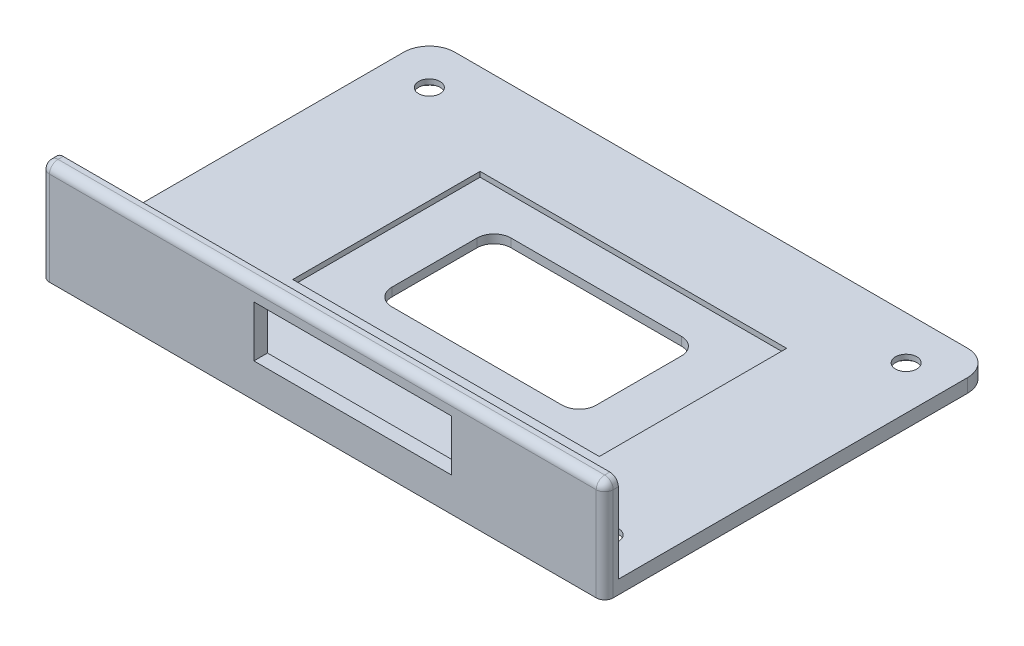
from build123d import *

# Parameters (mm, degrees)
EXTRUDE_1_DEPTH        = 1.6
SKETCH_2_W             = 23.2
SKETCH_2_H             = 6
EXTRUDE_719_DEPTH      = 1.6
CUT_EXTRUDE_1150_REACH = 43.961
SKETCH_5_R             = 2.6
CUT_EXTRUDE_1612_DEPTH = 1
CUT_EXTRUDE_1748_REACH = 44.114
SKETCH_7_R             = 1.25
SKETCH_9_W             = 36
SKETCH_9_H             = 22
CUT_EXTRUDE_2286_DEPTH = 0.6
FILLET_2_R             = 1


with BuildPart() as part:
    # 草图1 → 凸台-拉伸1 (new body)
    with BuildSketch(Plane(origin=(0, 0, 0), x_dir=(1, 0, 0), z_dir=(0, 1, 0))):
        with BuildLine():
            Line((-33.1, -22), (33.1, -22))
            Line((33.1, -22), (33.1, 19))
            ThreePointArc((33.1, 19), (32.221320344, 21.121320344), (30.1, 22))
            Line((30.1, 22), (-30.1, 22))
            ThreePointArc((-30.1, 22), (-32.221320344, 21.121320344), (-33.1, 19))
            Line((-33.1, 19), (-33.1, -22))
        make_face()
    extrude(amount=EXTRUDE_1_DEPTH)

    # 草图2 → Extrude 719 (add)
    with BuildSketch(Plane.XY.offset(22)):
        with BuildLine():
            Line((-33.1, 0), (33.1, 0))
            Line((33.1, 0), (33.1, 11))
            ThreePointArc((33.1, 11), (32.807106781, 11.707106781), (32.1, 12))
            Line((32.1, 12), (17.1, 12))
            Line((17.1, 12), (-9.1, 12))
            Line((-9.1, 12), (-32.1, 12))
            ThreePointArc((-32.1, 12), (-32.807106781, 11.707106781), (-33.1, 11))
            Line((-33.1, 11), (-33.1, 0))
        make_face()
        with Locations((3.5, 7)):
            Rectangle(SKETCH_2_W, SKETCH_2_H, mode=Mode.SUBTRACT)
    extrude(amount=EXTRUDE_719_DEPTH)

    # 草图3 → Cut-Extrude 1150 (cut, up to next)
    with BuildSketch(Plane(origin=(0, 1.6, 0), x_dir=(1, 0, 0), z_dir=(0, 1, 0)), mode=Mode.PRIVATE) as cut_extrude_1150_sk1:
        with BuildLine():
            Line((-8.5, -7), (11.5, -7))
            ThreePointArc((11.5, -7), (12.914213562, -6.414213562), (13.5, -5))
            Line((13.5, -5), (13.5, 5))
            ThreePointArc((13.5, 5), (12.914213562, 6.414213562), (11.5, 7))
            Line((11.5, 7), (-8.5, 7))
            ThreePointArc((-8.5, 7), (-9.914213562, 6.414213562), (-10.5, 5))
            Line((-10.5, 5), (-10.5, -5))
            ThreePointArc((-10.5, -5), (-9.914213562, -6.414213562), (-8.5, -7))
        make_face()
    cut_extrude_1150_tool1 = extrude(cut_extrude_1150_sk1.sketch, amount=-CUT_EXTRUDE_1150_REACH, mode=Mode.PRIVATE) & part.part
    add(cut_extrude_1150_tool1.solids().sort_by_distance((1.5, 1.6, 0))[0], mode=Mode.SUBTRACT)

    # 草图5 → Cut-Extrude 1612 (cut)
    with BuildSketch(Plane.XZ):
        with Locations((-28, -16.9)):
            Circle(SKETCH_5_R)
        with Locations((28, -16.9)):
            Circle(SKETCH_5_R)
        with Locations((28, 18.1)):
            Circle(SKETCH_5_R)
        with Locations((-28, 18.1)):
            Circle(SKETCH_5_R)
    extrude(amount=-CUT_EXTRUDE_1612_DEPTH, mode=Mode.SUBTRACT)

    # 草图7 → Cut-Extrude 1748 (cut, up to next)
    with BuildSketch(Plane.XZ.offset(-1), mode=Mode.PRIVATE) as cut_extrude_1748_sk1:
        with Locations((-28, -16.9)):
            Circle(SKETCH_7_R)
    cut_extrude_1748_tool1 = extrude(cut_extrude_1748_sk1.sketch, amount=-CUT_EXTRUDE_1748_REACH, mode=Mode.PRIVATE) & part.part
    # 草图7 → Cut-Extrude 1748 (cut, up to next)
    with BuildSketch(Plane.XZ.offset(-1), mode=Mode.PRIVATE) as cut_extrude_1748_sk2:
        with Locations((28, -16.9)):
            Circle(SKETCH_7_R)
    cut_extrude_1748_tool2 = extrude(cut_extrude_1748_sk2.sketch, amount=-CUT_EXTRUDE_1748_REACH, mode=Mode.PRIVATE) & part.part
    # 草图7 → Cut-Extrude 1748 (cut, up to next)
    with BuildSketch(Plane.XZ.offset(-1), mode=Mode.PRIVATE) as cut_extrude_1748_sk3:
        with Locations((28, 18.1)):
            Circle(SKETCH_7_R)
    cut_extrude_1748_tool3 = extrude(cut_extrude_1748_sk3.sketch, amount=-CUT_EXTRUDE_1748_REACH, mode=Mode.PRIVATE) & part.part
    # 草图7 → Cut-Extrude 1748 (cut, up to next)
    with BuildSketch(Plane.XZ.offset(-1), mode=Mode.PRIVATE) as cut_extrude_1748_sk4:
        with Locations((-28, 18.1)):
            Circle(SKETCH_7_R)
    cut_extrude_1748_tool4 = extrude(cut_extrude_1748_sk4.sketch, amount=-CUT_EXTRUDE_1748_REACH, mode=Mode.PRIVATE) & part.part
    add(cut_extrude_1748_tool1.solids().sort_by_distance((-28, 1, -16.9))[0], mode=Mode.SUBTRACT)
    add(cut_extrude_1748_tool2.solids().sort_by_distance((28, 1, -16.9))[0], mode=Mode.SUBTRACT)
    add(cut_extrude_1748_tool3.solids().sort_by_distance((28, 1, 18.1))[0], mode=Mode.SUBTRACT)
    add(cut_extrude_1748_tool4.solids().sort_by_distance((-28, 1, 18.1))[0], mode=Mode.SUBTRACT)

    # 草图9 → Cut-Extrude 2286 (cut)
    with BuildSketch(Plane(origin=(0, 1.6, 0), x_dir=(1, 0, 0), z_dir=(0, 1, 0))):
        with Locations((1.500900608, 0.362797629)):
            Rectangle(SKETCH_9_W, SKETCH_9_H)
    extrude(amount=-CUT_EXTRUDE_2286_DEPTH, mode=Mode.SUBTRACT)

    # 圆角2
    fillet_2_edges = [part.edges().sort_by_distance(p)[0] for p in [
        (33.1, 5.5, 23.6),
        (32.807106781, 11.707106781, 23.6),
        (-33.1, 5.5, 23.6),
        (-32.807106781, 11.707106781, 23.6),
        (0, 12, 23.6),
    ]]
    fillet(fillet_2_edges, radius=FILLET_2_R)


solid = part.part
